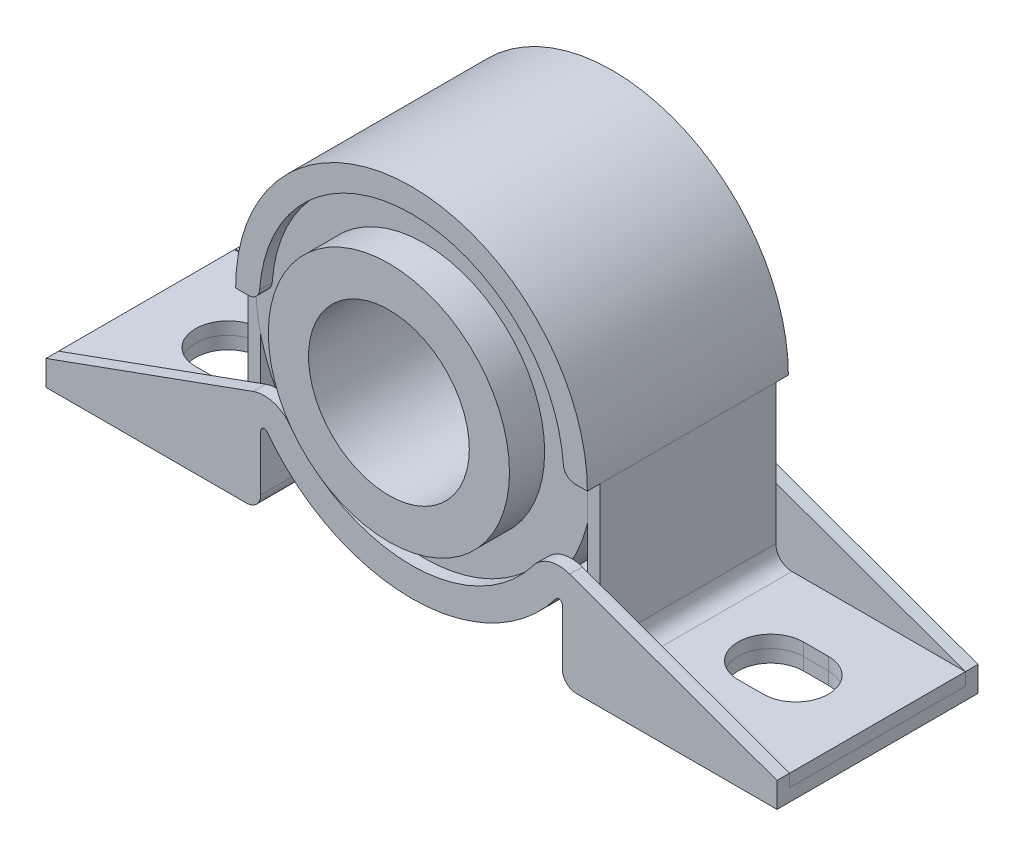
from build123d import *

# Parameters (mm, degrees)
EXTRUDE_THIN2_DEPTH      = 15.875
EXTRUDE1_DEPTH           = 1.984375
EXTRUDE_THIN3_DEPTH      = 13.890625
EXTRUDE_THIN3_DEPTH_BACK = 13.890625
EXTRUDE2_DEPTH           = 1.984375
EXTRUDE3_START           = -13.890625
EXTRUDE3_OUTLINE_R       = 26.590625
EXTRUDE3_OUTLINE_R_2     = 19.05
EXTRUDE3_DEPTH           = 27.78125
SKETCH8_R                = 19.05
SKETCH8_R_2              = 12.7
EXTRUDE4_DEPTH           = 26.9875
CUT_EXTRUDE1_DEPTH       = 68.299574204


# Read off the part's stored shape, not the designer's step: Extrude3
with BuildPart() as part:
    # Sketch1 → Extrude-Thin2 (new, symmetric)
    with BuildSketch(Plane.XY):
        with BuildLine():
            Line((-57.7453125, -26.590625), (-26.057225, -26.590625))
            ThreePointArc((-26.057225, -26.590625), (-25.877619878, -26.516230122), (-25.803225, -26.336625))
            Line((-25.803225, -26.336625), (-25.803225, -17.533273382))
            ThreePointArc((-25.803225, -17.533273382), (-24.069283693, -15.124566388), (-21.23482391, -16.004486602))
            ThreePointArc((-21.23482391, -16.004486602), (0, -26.590625), (21.23482391, -16.004486602))
            ThreePointArc((21.23482391, -16.004486602), (24.069283693, -15.124566388), (25.803225, -17.533273382))
            Line((25.803225, -17.533273382), (25.803225, -26.336625))
            ThreePointArc((25.803225, -26.336625), (25.877619878, -26.516230122), (26.057225, -26.590625))
            Line((26.057225, -26.590625), (57.7453125, -26.590625))
            Line((57.7453125, -26.590625), (57.7453125, -28.575))
            Line((57.7453125, -28.575), (26.057225, -28.575))
            ThreePointArc((26.057225, -28.575), (24.474454859, -27.919395141), (23.81885, -26.336625))
            Line((23.81885, -26.336625), (23.81885, -17.533273382))
            ThreePointArc((23.81885, -17.533273382), (23.439550339, -17.006368727), (22.819512262, -17.198851274))
            ThreePointArc((22.819512262, -17.198851274), (0, -28.575), (-22.819512262, -17.198851274))
            ThreePointArc((-22.819512262, -17.198851274), (-23.439550339, -17.006368727), (-23.81885, -17.533273382))
            Line((-23.81885, -17.533273382), (-23.81885, -26.336625))
            ThreePointArc((-23.81885, -26.336625), (-24.474454859, -27.919395141), (-26.057225, -28.575))
            Line((-26.057225, -28.575), (-57.7453125, -28.575))
            Line((-57.7453125, -28.575), (-57.7453125, -26.590625))
        make_face()
    extrude(amount=EXTRUDE_THIN2_DEPTH, both=True)

    # Sketch4 → Extrude1 (add)
    with BuildSketch(Plane.XY.offset(15.875)):
        with BuildLine():
            Line((-57.7453125, -24.60625), (-24.991480683, -12.756293971))
            ThreePointArc((-24.991480683, -12.756293971), (-21.815944337, -12.663799213), (-19.20642282, -14.475699822))
            ThreePointArc((-19.20642282, -14.475699822), (0, -24.050625), (19.20642282, -14.475699822))
            ThreePointArc((19.20642282, -14.475699822), (21.815944337, -12.663799213), (24.991480683, -12.756293971))
            Line((24.991480683, -12.756293971), (57.7453125, -24.60625))
            Line((57.7453125, -24.60625), (57.7453125, -28.575))
            Line((57.7453125, -28.575), (26.057225, -28.575))
            ThreePointArc((26.057225, -28.575), (24.474454859, -27.919395141), (23.81885, -26.336625))
            Line((23.81885, -26.336625), (23.81885, -17.533273382))
            ThreePointArc((23.81885, -17.533273382), (23.439550339, -17.006368727), (22.819512262, -17.198851274))
            ThreePointArc((22.819512262, -17.198851274), (0, -28.575), (-22.819512262, -17.198851274))
            ThreePointArc((-22.819512262, -17.198851274), (-23.439550339, -17.006368727), (-23.81885, -17.533273382))
            Line((-23.81885, -17.533273382), (-23.81885, -26.336625))
            ThreePointArc((-23.81885, -26.336625), (-24.474454859, -27.919395141), (-26.057225, -28.575))
            Line((-26.057225, -28.575), (-57.7453125, -28.575))
            Line((-57.7453125, -28.575), (-57.7453125, -24.60625))
        make_face()
    extrude1 = extrude(amount=-EXTRUDE1_DEPTH)

    # Mirror1: Extrude1 across plane
    add(extrude1.mirror(Plane.XY))


with BuildPart() as body_2:
    # Sketch5 → Extrude-Thin3 (new, two sides: drawn at the far end of the back side and taken through both)
    with BuildSketch(Plane.XY.offset(-EXTRUDE_THIN3_DEPTH_BACK)):
        with BuildLine():
            Line((57.7453125, -24.60625), (30.3276, -24.60625))
            ThreePointArc((30.3276, -24.60625), (28.531548776, -23.862301224), (27.7876, -22.06625))
            Line((27.7876, -22.06625), (27.7876, 0))
            ThreePointArc((27.7876, 0), (0, 27.7876), (-27.7876, 0))
            Line((-27.7876, 0), (-27.7876, -22.06625))
            ThreePointArc((-27.7876, -22.06625), (-28.531548776, -23.862301224), (-30.3276, -24.60625))
            Line((-30.3276, -24.60625), (-57.7453125, -24.60625))
            Line((-57.7453125, -24.60625), (-57.7453125, -26.590625))
            Line((-57.7453125, -26.590625), (-30.3276, -26.590625))
            ThreePointArc((-30.3276, -26.590625), (-27.128383757, -25.265466243), (-25.803225, -22.06625))
            Line((-25.803225, -22.06625), (-25.803225, 0))
            ThreePointArc((-25.803225, 0), (0, 25.803225), (25.803225, 0))
            Line((25.803225, 0), (25.803225, -22.06625))
            ThreePointArc((25.803225, -22.06625), (27.128383757, -25.265466243), (30.3276, -26.590625))
            Line((30.3276, -26.590625), (57.7453125, -26.590625))
            Line((57.7453125, -26.590625), (57.7453125, -24.60625))
        make_face()
    extrude(amount=EXTRUDE_THIN3_DEPTH + EXTRUDE_THIN3_DEPTH_BACK)

    # Sketch6 → Extrude2 (add)
    with BuildSketch(Plane(origin=(0, 0, -13.890625), x_dir=(-1, 0, 0), z_dir=(0, 0, -1))):
        with BuildLine():
            Line((-25.803225, 0), (-27.7876, 0))
            ThreePointArc((-27.7876, 0), (0, 27.7876), (27.7876, 0))
            Line((27.7876, 0), (25.803225, 0))
            ThreePointArc((25.803225, 0), (24.56471473, 0.487695001), (23.991252112, 1.688900533))
            ThreePointArc((23.991252112, 1.688900533), (0, 24.050625), (-23.991252112, 1.688900533))
            ThreePointArc((-23.991252112, 1.688900533), (-24.56471473, 0.487695001), (-25.803225, 0))
        make_face()
    extrude2 = extrude(amount=EXTRUDE2_DEPTH)

    # Mirror2: Extrude2 across plane
    add(extrude2.mirror(Plane.XY))


with BuildPart() as body_3:
    # Extrude3 outline → Extrude3 (new body)
    with BuildSketch(Plane.XY.offset(EXTRUDE3_START)):
        Circle(EXTRUDE3_OUTLINE_R)
        Circle(EXTRUDE3_OUTLINE_R_2, mode=Mode.SUBTRACT)
    extrude(amount=EXTRUDE3_DEPTH)


with BuildPart() as body_4:
    # Sketch8 → Extrude4 (new body)
    with BuildSketch(Plane.XY.offset(19.446875)):
        Circle(SKETCH8_R)
        Circle(SKETCH8_R_2, mode=Mode.SUBTRACT)
    extrude(amount=-EXTRUDE4_DEPTH)


with BuildPart() as cut_extrude1_tool:
    # Sketch3 → Cut-Extrude1 (new, through all)
    with BuildSketch(Plane(origin=(0, 0, 0), x_dir=(1, 0, 0), z_dir=(0, 1, 0))):
        with BuildLine():
            Line((-44.846875, 5.159375), (-40.878125, 5.159375))
            ThreePointArc((-40.878125, 5.159375), (-35.71875, 0), (-40.878125, -5.159375))
            Line((-40.878125, -5.159375), (-44.846875, -5.159375))
            ThreePointArc((-44.846875, -5.159375), (-50.00625, 0), (-44.846875, 5.159375))
        make_face()
        with BuildLine():
            Line((40.878125, -5.159375), (44.846875, -5.159375))
            ThreePointArc((44.846875, -5.159375), (50.00625, 0), (44.846875, 5.159375))
            Line((44.846875, 5.159375), (40.878125, 5.159375))
            ThreePointArc((40.878125, 5.159375), (35.71875, 0), (40.878125, -5.159375))
        make_face()
    extrude(amount=-CUT_EXTRUDE1_DEPTH)


with BuildPart() as part_1:
    add(part.part)

    # Cut-Extrude1: cut by cut_extrude1_tool
    add(cut_extrude1_tool.part, mode=Mode.SUBTRACT)


with BuildPart() as body_2_1:
    add(body_2.part)

    # Cut-Extrude1: cut by cut_extrude1_tool
    add(cut_extrude1_tool.part, mode=Mode.SUBTRACT)


solid = Compound([body_3.part, body_4.part, part_1.part, body_2_1.part])
